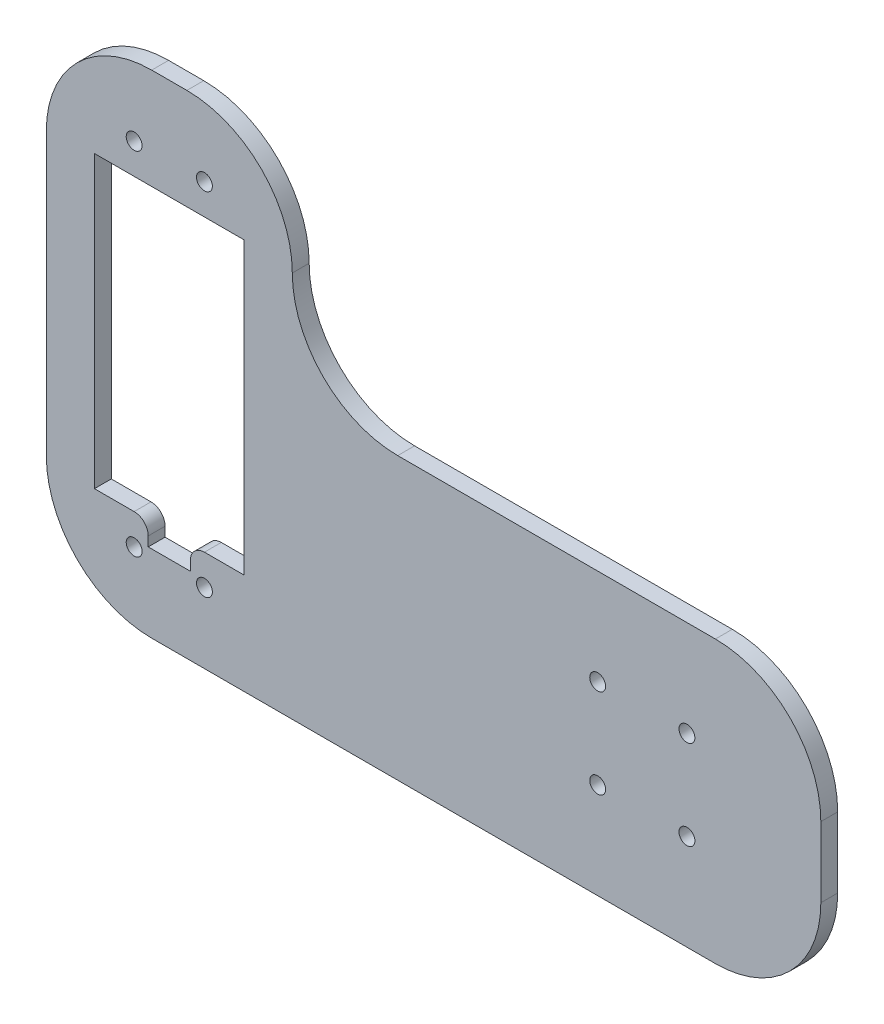
from build123d import *

# Parameters (mm, degrees)
SKETCH1_R           = 1.13
SKETCH1_W           = 20
SKETCH1_H           = 40
BOSS_EXTRUDE1_DEPTH = 2.4
SKETCH2_W           = 6
SKETCH2_H           = 4
CUT_EXTRUDE1_DEPTH  = 2.4
SKETCH3_W           = 21.3
SKETCH3_H           = 41.3
SKETCH3_W_2         = 20
SKETCH3_H_2         = 40
CUT_EXTRUDE2_DEPTH  = 2.4
FILLET1_R           = 2
FILLET2_R           = 15


with BuildPart() as part:
    # Sketch1 → Boss-Extrude1 (new body)
    with BuildSketch(Plane.XY):
        Polygon((-96.067052023, 12.037572254), (-61.067052023, 12.037572254), (-61.067052023, -17.962427746), (14.132947977, -17.962427746), (14.132947977, -57.962427746), (-96.067052023, -57.962427746), align=None)
        with Locations((-4.917052023, -31.612427746)):
            Circle(SKETCH1_R, mode=Mode.SUBTRACT)
        with Locations(Location((-17.617052023, -31.612427746, 0), (0, 0, 180))):
            Circle(SKETCH1_R, mode=Mode.SUBTRACT)
        with Locations((-17.617052023, -44.312427746)):
            Circle(SKETCH1_R, mode=Mode.SUBTRACT)
        with Locations(Location((-4.917052023, -44.312427746, 0), (0, 0, 180))):
            Circle(SKETCH1_R, mode=Mode.SUBTRACT)
        with Locations((-73.567052023, 2.037572254)):
            Circle(SKETCH1_R, mode=Mode.SUBTRACT)
        with Locations((-73.567052023, -47.962427746)):
            Circle(SKETCH1_R, mode=Mode.SUBTRACT)
        with Locations(Location((-83.567052023, 2.037572254, 0), (0, 0, 180))):
            Circle(SKETCH1_R, mode=Mode.SUBTRACT)
        with Locations(Location((-83.567052023, -47.962427746, 0), (0, 0, 180))):
            Circle(SKETCH1_R, mode=Mode.SUBTRACT)
        with Locations((-78.567052023, -22.962427746)):
            Rectangle(SKETCH1_W, SKETCH1_H, mode=Mode.SUBTRACT)
    extrude(amount=BOSS_EXTRUDE1_DEPTH)

    # Sketch2 → Cut-Extrude1 (cut)
    with BuildSketch(Plane.XY.offset(2.4)):
        with Locations((-78.567052023, -44.962427746)):
            Rectangle(SKETCH2_W, SKETCH2_H)
    extrude(amount=-CUT_EXTRUDE1_DEPTH, mode=Mode.SUBTRACT)

    # Sketch3 → Cut-Extrude2 (cut)
    with BuildSketch(Plane.XY.offset(2.4)):
        with Locations((-78.567052023, -22.962427746)):
            Rectangle(SKETCH3_W, SKETCH3_H)
        with Locations((-78.567052023, -22.962427746)):
            Rectangle(SKETCH3_W_2, SKETCH3_H_2, mode=Mode.SUBTRACT)
    extrude(amount=-CUT_EXTRUDE2_DEPTH, mode=Mode.SUBTRACT)

    # Fillet1
    fillet1_edges = [part.edges().sort_by_distance(p)[0] for p in [
        (-75.567052023, -43.612427746, 1.2),
        (-81.567052023, -43.612427746, 1.2),
    ]]
    fillet(fillet1_edges, radius=FILLET1_R)

    # Fillet2
    fillet2_edges = [part.edges().sort_by_distance(p)[0] for p in [
        (-61.067052023, -17.962427746, 1.2),
        (14.132947977, -17.962427746, 1.2),
        (14.132947977, -57.962427746, 1.2),
        (-96.067052023, -57.962427746, 1.2),
        (-61.067052023, 12.037572254, 1.2),
        (-96.067052023, 12.037572254, 1.2),
    ]]
    fillet(fillet2_edges, radius=FILLET2_R - 0.0001)  # a hair under: the kernel refuses the full size


solid = part.part
